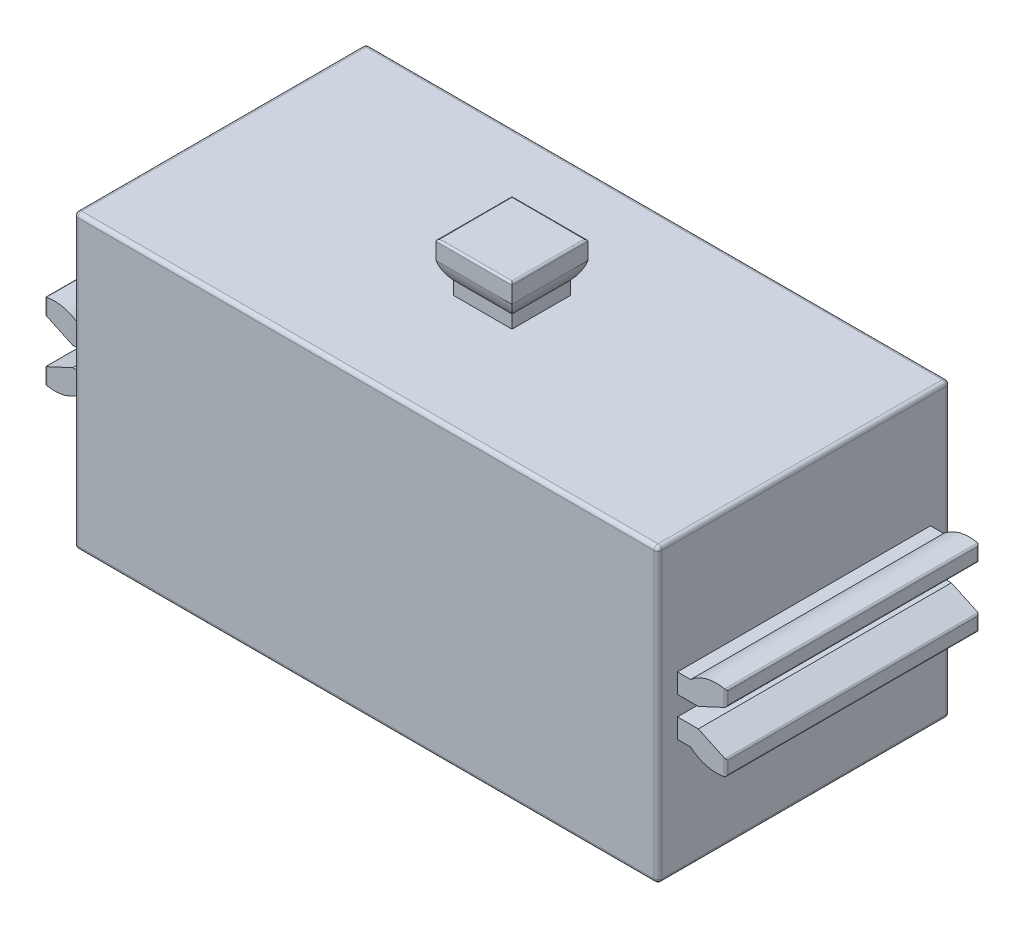
from build123d import *

# Parameters (mm, degrees)
EXTRUDE_1_DEPTH      = 7.5
EXTRUDE_1_DEPTH_BACK = 7.5
SKETCH_1_W           = 30
SKETCH_1_H           = 15
EXTRUDE_START        = -1
EXTRUDE_2_DEPTH      = 13
SKETCH_3_W           = 3
SKETCH_3_H           = 3
EXTRUDE_3_DEPTH      = 1
EXTRUDE_4_DEPTH      = 2
EXTRUDE_4_DEPTH_BACK = 3
CUT_EXTRUDE_1_REACH  = 25.12
FILLET_1_R           = 0.1
FILLET_2_R           = 0.2
SKETCH_6_R           = 1.7
CUT_EXTRUDE_2_DEPTH  = 1


with BuildPart() as part:
    # 草图1 → 凸台-拉伸1 (new, two sides: drawn at the far end of the back side and taken through both)
    with BuildSketch(Plane.XY.offset(-EXTRUDE_1_DEPTH_BACK)):
        Rectangle(SKETCH_1_W, SKETCH_1_H)
    extrude(amount=EXTRUDE_1_DEPTH + EXTRUDE_1_DEPTH_BACK)

    # 草图2 → 凸台-拉伸2 (add)
    with BuildSketch(Plane.XY.offset(7.5).offset(EXTRUDE_START)):
        with BuildLine():
            Line((-15.677124344, 1.5), (-15, 1.5))
            Line((-15, 1.5), (-15, 0.5))
            Line((-15, 0.5), (-16.07225346, 0.5))
            Line((-16.07225346, 0.5), (-17.5, 1.165769145))
            Line((-17.5, 1.165769145), (-17.5, 1.936491673))
            ThreePointArc((-17.5, 1.936491673), (-16.53426152, 1.94501611), (-15.677124344, 1.5))
        make_face()
        with BuildLine():
            Line((-15.677124344, -1.5), (-15, -1.5))
            Line((-15, -1.5), (-15, -0.5))
            Line((-15, -0.5), (-16.07225346, -0.5))
            Line((-16.07225346, -0.5), (-17.5, -1.165769145))
            Line((-17.5, -1.165769145), (-17.5, -1.936491673))
            ThreePointArc((-17.5, -1.936491673), (-16.53426152, -1.94501611), (-15.677124344, -1.5))
        make_face()
        with BuildLine():
            Line((15, -0.5), (15, -1.5))
            Line((15, -1.5), (15.677124344, -1.5))
            ThreePointArc((15.677124344, -1.5), (16.53426152, -1.94501611), (17.5, -1.936491673))
            Line((17.5, -1.936491673), (17.5, -1.165769145))
            Line((17.5, -1.165769145), (16.07225346, -0.5))
            Line((16.07225346, -0.5), (15, -0.5))
        make_face()
        with BuildLine():
            Line((15, 0.5), (16.07225346, 0.5))
            Line((16.07225346, 0.5), (17.5, 1.165769145))
            Line((17.5, 1.165769145), (17.5, 1.936491673))
            ThreePointArc((17.5, 1.936491673), (16.53426152, 1.94501611), (15.677124344, 1.5))
            Line((15.677124344, 1.5), (15, 1.5))
            Line((15, 1.5), (15, 0.5))
        make_face()
    extrude(amount=-EXTRUDE_2_DEPTH)

    # 草图3 → 凸台-拉伸3 (add)
    with BuildSketch(Plane(origin=(0, 7.5, 0), x_dir=(-1, 0, 0), z_dir=(0, 1, 0))):
        Rectangle(SKETCH_3_W, SKETCH_3_H)
    extrude(amount=EXTRUDE_3_DEPTH)

    # 草图4 → 凸台-拉伸4 (add, two sides: drawn at the far end of the back side and taken through both)
    with BuildSketch(Plane.XY.offset(-EXTRUDE_4_DEPTH_BACK)):
        with BuildLine():
            Line((-1.95, 10), (1.95, 10))
            Line((1.95, 10), (1.95, 9.055590279))
            ThreePointArc((1.95, 9.055590279), (1.780042303, 8.588161527), (1.5, 8.177124344))
            Line((1.5, 8.177124344), (-1.5, 8.177124344))
            ThreePointArc((-1.5, 8.177124344), (-1.780042303, 8.588161527), (-1.95, 9.055590279))
            Line((-1.95, 9.055590279), (-1.95, 10))
        make_face()
    extrude(amount=EXTRUDE_4_DEPTH + EXTRUDE_4_DEPTH_BACK)

    # 草图5 → 切除-拉伸1 (cut, up to next)
    with BuildSketch(Plane(origin=(1.95, 0, 0), x_dir=(0, 0, -1), z_dir=(1, 0, 0)), mode=Mode.PRIVATE) as cut_extrude_1_sk1:
        with BuildLine():
            Line((-1.95, 10), (-1.95, 9.055590279))
            ThreePointArc((-1.95, 9.055590279), (-1.780042303, 8.588161527), (-1.5, 8.177124344))
            Line((-1.5, 8.177124344), (-2, 8.177124344))
            Line((-2, 8.177124344), (-2, 10))
            Line((-2, 10), (-1.95, 10))
        make_face()
    cut_extrude_1_tool1 = extrude(cut_extrude_1_sk1.sketch, amount=-CUT_EXTRUDE_1_REACH, mode=Mode.PRIVATE) & part.part
    # 草图5 → 切除-拉伸1 (cut, up to next)
    with BuildSketch(Plane(origin=(1.95, 0, 0), x_dir=(0, 0, -1), z_dir=(1, 0, 0)), mode=Mode.PRIVATE) as cut_extrude_1_sk2:
        with BuildLine():
            Line((3, 10), (3, 8.177124344))
            Line((3, 8.177124344), (1.5, 8.177124344))
            ThreePointArc((1.5, 8.177124344), (1.780042303, 8.588161527), (1.95, 9.055590279))
            Line((1.95, 9.055590279), (1.95, 10))
            Line((1.95, 10), (3, 10))
        make_face()
    cut_extrude_1_tool2 = extrude(cut_extrude_1_sk2.sketch, amount=-CUT_EXTRUDE_1_REACH, mode=Mode.PRIVATE) & part.part
    add(cut_extrude_1_tool1.solids().sort_by_distance((1.95, 8.675075, 1.873038))[0], mode=Mode.SUBTRACT)
    add(cut_extrude_1_tool2.solids().sort_by_distance((1.95, 9.039049, -2.424924))[0], mode=Mode.SUBTRACT)

    # 圆角1
    fillet_1_edges = [part.edges().sort_by_distance(p)[0] for p in [
        (1.95, 10, 0),
        (0, 10, 1.95),
        (-1.95, 10, 0),
        (0, 10, -1.95),
        (-17.5, -1.936491673, 0),
        (-17.5, -1.551130409, -6.5),
        (-17.5, -1.165769145, 0),
        (-17.5, -1.551130409, 6.5),
        (-17.5, 1.165769145, 0),
        (-17.5, 1.551130409, -6.5),
        (-17.5, 1.936491673, 0),
        (-17.5, 1.551130409, 6.5),
        (17.5, -1.165769145, 0),
        (17.5, -1.551130409, -6.5),
        (17.5, -1.936491673, 0),
        (17.5, -1.551130409, 6.5),
        (17.5, 1.936491673, 0),
        (17.5, 1.551130409, -6.5),
        (17.5, 1.165769145, 0),
        (17.5, 1.551130409, 6.5),
    ]]
    fillet(fillet_1_edges, radius=FILLET_1_R)

    # 圆角2
    fillet_2_edges = [part.edges().sort_by_distance(p)[0] for p in [
        (0, -7.5, -7.5),
        (15, 0, -7.5),
        (0, 7.5, -7.5),
        (-15, 0, -7.5),
        (0, 7.5, 7.5),
        (15, 0, 7.5),
        (0, -7.5, 7.5),
        (-15, 0, 7.5),
        (-15, -7.5, 0),
        (-15, 7.5, 0),
        (15, 7.5, 0),
        (15, -7.5, 0),
    ]]
    fillet(fillet_2_edges, radius=FILLET_2_R)

    # 草图6 → 切除-拉伸2 (cut)
    with BuildSketch(Plane.XZ.offset(7.5)):
        with Locations((-2.8, 0)):
            Circle(SKETCH_6_R)
    cut_extrude_2 = extrude(amount=-CUT_EXTRUDE_2_DEPTH, mode=Mode.SUBTRACT)

    # 镜向2: 切除-拉伸2 across plane
    add(cut_extrude_2.mirror(Plane(origin=(0, 0, 0), x_dir=(0, 0, 1), z_dir=(1, 0, 0))), mode=Mode.SUBTRACT)


solid = part.part
